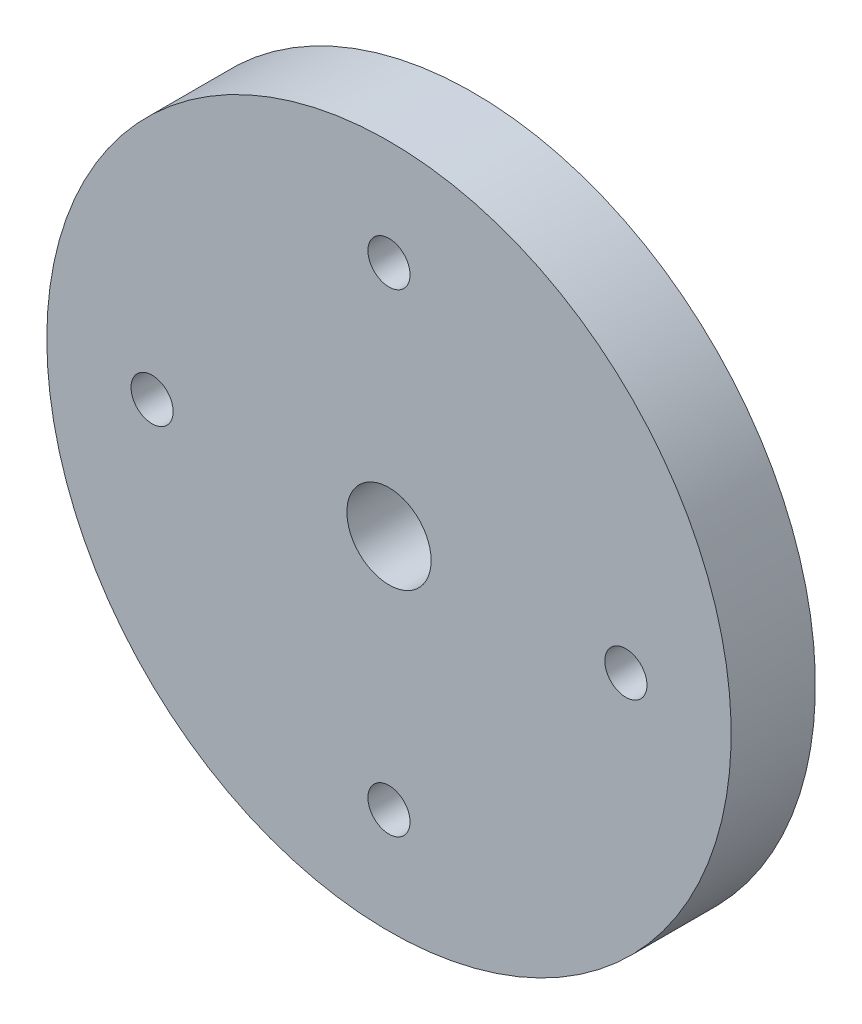
from build123d import *

# Parameters (mm, degrees)
F_4_0_4_HEAT_INSERT_M3_D        = 4
F_8_0_8_DURCHMESSER_BOHRUNG1_D  = 8
SKIZZE8_R                       = 2
SCHNITT_LINEAR_AUSTRAGEN1_DEPTH = 7


with BuildPart() as part:
    # Skizze1 → Rotation1 (revolve)
    with BuildSketch(Plane(origin=(0, 0, 0), x_dir=(0, 0, -1), z_dir=(1, 0, 0))):
        Polygon((0, 0), (20, 0), (20, 15), (8, 15), (8, 32.5), (0, 32.5), align=None)
    revolve(axis=Axis((0, 0, 0), (0, 0, 1)))

    # Ø4.0 (4) Heat Insert M3 (through all)
    with Locations(Plane.XY):
        with Locations((22.5, 0), (0, 22.5), (-22.5, 0), (0, -22.5)):
            Hole(F_4_0_4_HEAT_INSERT_M3_D / 2)

    # Ø8.0 (8) Durchmesser Bohrung1 (through all)
    with Locations(Plane.XY):
        with Locations((0, 0)):
            Hole(F_8_0_8_DURCHMESSER_BOHRUNG1_D / 2)

    # Skizze8 → Schnitt-Linear austragen1 (cut)
    with BuildSketch(Plane(origin=(0, 0, -20), x_dir=(-1, 0, 0), z_dir=(0, 0, -1))):
        with Locations((0, 10)):
            Circle(SKIZZE8_R)
        with Locations((8.660254038, -5)):
            Circle(SKIZZE8_R)
        with Locations((-8.660254038, -5)):
            Circle(SKIZZE8_R)
    extrude(amount=-SCHNITT_LINEAR_AUSTRAGEN1_DEPTH, mode=Mode.SUBTRACT)


solid = part.part
